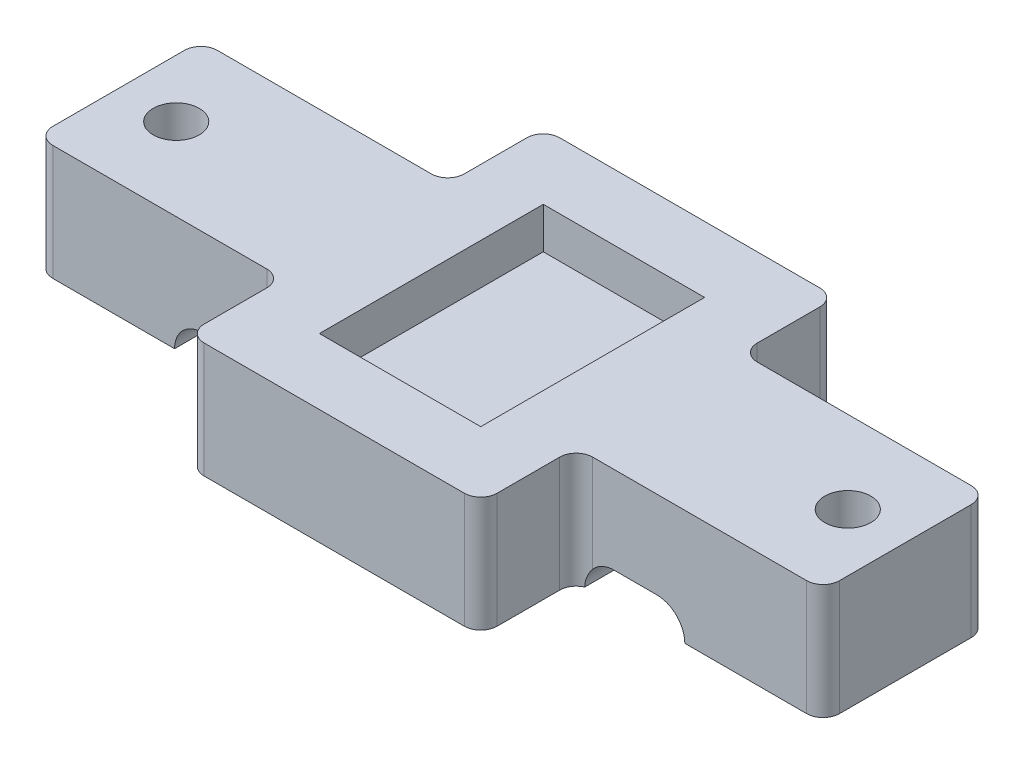
from build123d import *

# Parameters (mm, degrees)
BASE_DEPTH                = 7
SKETCH2_W                 = 9.8
SKETCH2_H                 = 13.6
PCB_CUTOUT_DEPTH          = 2.5
BASKET_WIRE_GROOVES_DEPTH = 30.49321956
SKETCH5_R                 = 1.4
SCREW_HOLES_DEPTH         = 28.14498112
F_1MM_EDGE_FILLETS_R      = 1


with BuildPart() as part:
    # Sketch1 → Base (new body)
    with BuildSketch(Plane(origin=(0, 0, 0), x_dir=(1, 0, 0), z_dir=(0, 1, 0))):
        Polygon((-8.9, 10.8), (-8.9, 5), (-23.9, 5), (-23.9, -5), (-8.9, -5), (-8.9, -10.8), (8.9, -10.8), (8.9, -5), (23.9, -5), (23.9, 5), (8.9, 5), (8.9, 10.8), (0, 10.8), align=None)
    extrude(amount=BASE_DEPTH)

    # Sketch2 → PCB Cutout (cut)
    with BuildSketch(Plane(origin=(0, 7, 0), x_dir=(1, 0, 0), z_dir=(0, 1, 0))):
        Rectangle(SKETCH2_W, SKETCH2_H)
    extrude(amount=-PCB_CUTOUT_DEPTH, mode=Mode.SUBTRACT)

    # Sketch4 → Basket Wire Grooves (cut, through all)
    with BuildSketch(Plane(origin=(0, 0, -5), x_dir=(-1, 0, 0), z_dir=(0, 0, -1))):
        with BuildLine():
            Line((-9.5, 0), (-15.5, 0))
            ThreePointArc((-15.5, 0), (-15.002081528, 1.202081528), (-13.8, 1.7))
            Line((-13.8, 1.7), (-11.2, 1.7))
            ThreePointArc((-11.2, 1.7), (-9.997918472, 1.202081528), (-9.5, 0))
        make_face()
        with BuildLine():
            Line((13.8, 1.7), (11.2, 1.7))
            ThreePointArc((11.2, 1.7), (9.997918472, 1.202081528), (9.5, 0))
            Line((9.5, 0), (15.5, 0))
            ThreePointArc((15.5, 0), (15.002081528, 1.202081528), (13.8, 1.7))
        make_face()
    extrude(amount=-BASKET_WIRE_GROOVES_DEPTH, mode=Mode.SUBTRACT)

    # Sketch5 → Screw Holes (cut, through all)
    with BuildSketch(Plane.XZ):
        with Locations(Location((-20.4, 0, 0), (0, 0, 270))):
            Circle(SKETCH5_R)
        with Locations(Location((20.4, 0, 0), (0, 0, 90))):
            Circle(SKETCH5_R)
    extrude(amount=-SCREW_HOLES_DEPTH, mode=Mode.SUBTRACT)

    # 1mm Edge Fillets
    # the kernel refuses this fillet: 1 mm, written as the material it adds along each edge
    with BuildSketch(Plane(origin=(8.9, 0, -5), x_dir=(0, 0, -1), z_dir=(0, 1, 0))) as f_1mm_edge_fillets_piece_1_section:
        with BuildLine():
            CenterArc((F_1MM_EDGE_FILLETS_R, -F_1MM_EDGE_FILLETS_R), F_1MM_EDGE_FILLETS_R, 90, 90)
            Line((0, -F_1MM_EDGE_FILLETS_R), (0, 0))
            Line((0, 0), (F_1MM_EDGE_FILLETS_R, 0))
        make_face()
    f_1mm_edge_fillets_piece_1 = extrude(amount=7, mode=Mode.PRIVATE)
    f_1mm_edge_fillets_piece_1 = f_1mm_edge_fillets_piece_1 - Plane(origin=(11.2, 0, -5.227855897), x_dir=(0, 1, 0), z_dir=(0, 0, -1)) * Cylinder(1.7, 18, mode=Mode.PRIVATE)
    add(f_1mm_edge_fillets_piece_1)
    with BuildSketch(Plane(origin=(8.9, 0, 5), x_dir=(1, 0, 0), z_dir=(0, 1, 0))) as f_1mm_edge_fillets_piece_2_section:
        with BuildLine():
            CenterArc((F_1MM_EDGE_FILLETS_R, -F_1MM_EDGE_FILLETS_R), F_1MM_EDGE_FILLETS_R, 90, 90)
            Line((0, -F_1MM_EDGE_FILLETS_R), (0, 0))
            Line((0, 0), (F_1MM_EDGE_FILLETS_R, 0))
        make_face()
    f_1mm_edge_fillets_piece_2 = extrude(amount=7, mode=Mode.PRIVATE)
    f_1mm_edge_fillets_piece_2 = f_1mm_edge_fillets_piece_2 - Plane(origin=(11.2, 0, 5.227855907), x_dir=(0, 1, 0), z_dir=(0, 0, -1)) * Cylinder(1.7, 19, mode=Mode.PRIVATE)
    add(f_1mm_edge_fillets_piece_2)
    with BuildSketch(Plane(origin=(-8.9, 0, 5), x_dir=(0, 0, 1), z_dir=(0, 1, 0))) as f_1mm_edge_fillets_piece_3_section:
        with BuildLine():
            CenterArc((F_1MM_EDGE_FILLETS_R, -F_1MM_EDGE_FILLETS_R), F_1MM_EDGE_FILLETS_R, 90, 90)
            Line((0, -F_1MM_EDGE_FILLETS_R), (0, 0))
            Line((0, 0), (F_1MM_EDGE_FILLETS_R, 0))
        make_face()
    f_1mm_edge_fillets_piece_3 = extrude(amount=7, mode=Mode.PRIVATE)
    f_1mm_edge_fillets_piece_3 = f_1mm_edge_fillets_piece_3 - Plane(origin=(-11.2, 0, 5.227855897), x_dir=(0, 1, 0), z_dir=(0, 0, -1)) * Cylinder(1.7, 18, mode=Mode.PRIVATE)
    add(f_1mm_edge_fillets_piece_3)
    with BuildSketch(Plane(origin=(-8.9, 0, -5), x_dir=(0, 0, -1), z_dir=(0, 1, 0))) as f_1mm_edge_fillets_piece_4_section:
        with BuildLine():
            CenterArc((F_1MM_EDGE_FILLETS_R, F_1MM_EDGE_FILLETS_R), F_1MM_EDGE_FILLETS_R, 180, 90)
            Line((0, F_1MM_EDGE_FILLETS_R), (0, 0))
            Line((0, 0), (F_1MM_EDGE_FILLETS_R, 0))
        make_face()
    f_1mm_edge_fillets_piece_4 = extrude(amount=7, mode=Mode.PRIVATE)
    f_1mm_edge_fillets_piece_4 = f_1mm_edge_fillets_piece_4 - Plane(origin=(-11.2, 0, -5.227855897), x_dir=(0, 1, 0), z_dir=(0, 0, -1)) * Cylinder(1.7, 19, mode=Mode.PRIVATE)
    add(f_1mm_edge_fillets_piece_4)
    # the kernel refuses this fillet: 1 mm, written as the material it takes off along each edge
    with BuildSketch(Plane(origin=(8.9, -2.5, -10.8), x_dir=(-1, 0, 0), z_dir=(0, 1, 0)), Plane(origin=(23.9, -2.5, -5), x_dir=(-1, 0, 0), z_dir=(0, 1, 0)), Plane(origin=(23.9, -2.5, 5), x_dir=(0, 0, -1), z_dir=(0, 1, 0)), Plane(origin=(8.9, -2.5, 10.8), x_dir=(0, 0, -1), z_dir=(0, 1, 0)), Plane(origin=(-8.9, -2.5, 10.8), x_dir=(1, 0, 0), z_dir=(0, 1, 0)), Plane(origin=(-23.9, -2.5, 5), x_dir=(1, 0, 0), z_dir=(0, 1, 0)), Plane(origin=(-23.9, -2.5, -5), x_dir=(0, 0, 1), z_dir=(0, 1, 0)), Plane(origin=(-8.9, -2.5, -10.8), x_dir=(0, 0, 1), z_dir=(0, 1, 0))) as f_1mm_edge_fillets_2_piece_1:
        with BuildLine():
            CenterArc((F_1MM_EDGE_FILLETS_R, F_1MM_EDGE_FILLETS_R), F_1MM_EDGE_FILLETS_R, 180, 90)
            Line((0, F_1MM_EDGE_FILLETS_R), (0, 0))
            Line((0, 0), (F_1MM_EDGE_FILLETS_R, 0))
        make_face()
    extrude(amount=12, mode=Mode.SUBTRACT)


solid = part.part
